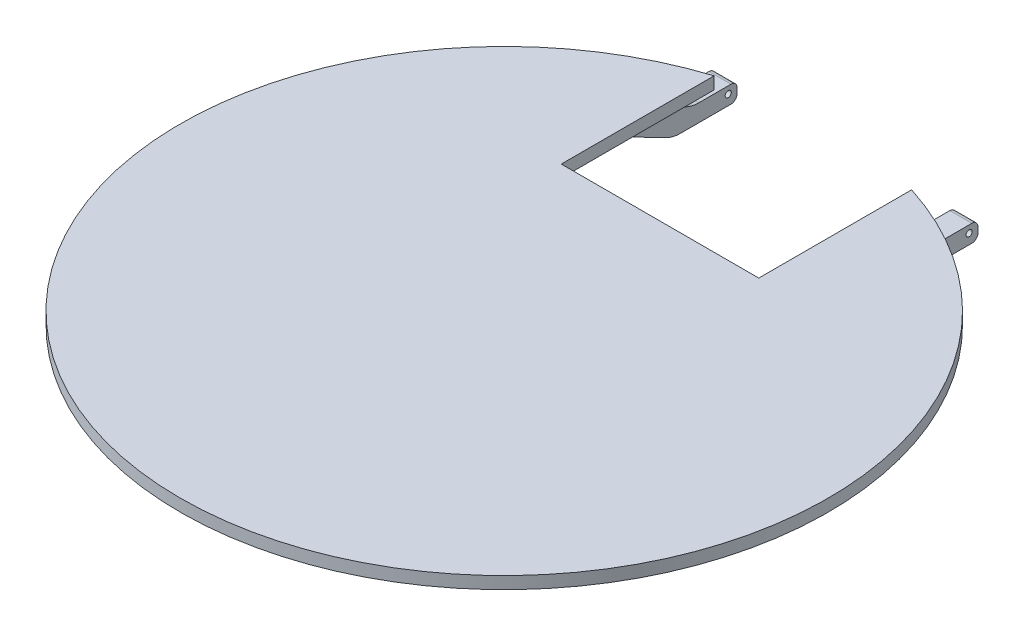
from build123d import *

# Parameters (mm, degrees)
ESTRUSIONE_ESTRUSIONE1_DEPTH = 4
SCHIZZO3_R                   = 1
ESTRUSIONE_ESTRUSIONE2_DEPTH = 7.2
RIPETIZIONE_A_L1_COUNT       = 2
RIPETIZIONE_A_L1_PITCH       = 78.8
TAGLIO_ESTRUSIONE1_DEPTH     = 0.0001


with BuildPart() as part:
    # Schizzo1 → Estrusione-Estrusione1 (new body)
    with BuildSketch(Plane(origin=(0, 0, 0), x_dir=(1, 0, 0), z_dir=(0, 1, 0))):
        with BuildLine():
            ThreePointArc((-32.3, 100.958952055), (0, -106), (32.3, 100.958952055))
            Line((32.3, 100.958952055), (32.3, 50.958952055))
            Line((32.3, 50.958952055), (-32.3, 50.958952055))
            Line((-32.3, 50.958952055), (-32.3, 100.958952055))
        make_face()
    extrude(amount=ESTRUSIONE_ESTRUSIONE1_DEPTH)

    # Schizzo4 → Taglio-Estrusione1 (cut)
    with BuildSketch(Plane.XZ):
        with BuildLine():
            Line((68, -41), (68, 74))
            Line((68, 74), (-75.894663844, 74))
            ThreePointArc((-75.894663844, 74), (-104.136158772, 19.790412733), (-97.749680306, -41))
            Line((-97.749680306, -41), (68, -41))
        make_face()
    extrude(amount=-TAGLIO_ESTRUSIONE1_DEPTH, mode=Mode.SUBTRACT)


with BuildPart() as body_2:
    # Schizzo3 → Estrusione-Estrusione2 (new body)
    with BuildSketch(Plane.ZY.offset(-35.8)):
        with BuildLine():
            Line((-70.958952055, 0), (-90.958952055, 0))
            Line((-90.958952055, 0), (-91.637551092, -0.854213861))
            ThreePointArc((-91.637551092, -0.854213861), (-95.120257392, -3.639592846), (-99.467531221, -4.633971809))
            Line((-99.467531221, -4.633971809), (-109.968629526, -4.633971809))
            ThreePointArc((-109.968629526, -4.633971809), (-111.382843089, -5.219758246), (-111.968629526, -6.633971809))
            Line((-111.968629526, -6.633971809), (-111.968629526, -8.301701811))
            ThreePointArc((-111.968629526, -8.301701811), (-111.382843089, -9.715915373), (-109.968629526, -10.301701811))
            Line((-109.968629526, -10.301701811), (-93.383040263, -10.301701811))
            ThreePointArc((-93.383040263, -10.301701811), (-91.027181563, -10.020237183), (-88.803941042, -9.191687768))
            Line((-88.803941042, -9.191687768), (-70.958952055, 0))
        make_face()
        with Locations((-109.068952055, -7)):
            Circle(SCHIZZO3_R, mode=Mode.SUBTRACT)
    extrude(amount=-ESTRUSIONE_ESTRUSIONE2_DEPTH)


with BuildPart() as ripetizione_a_l1_1:
    # Ripetizione a L1: pattern copy
    add(body_2.part.moved(Location(Vector(-1, 0, 0) * (1 * RIPETIZIONE_A_L1_PITCH))))


solid = Compound([part.part, body_2.part, ripetizione_a_l1_1.part])
